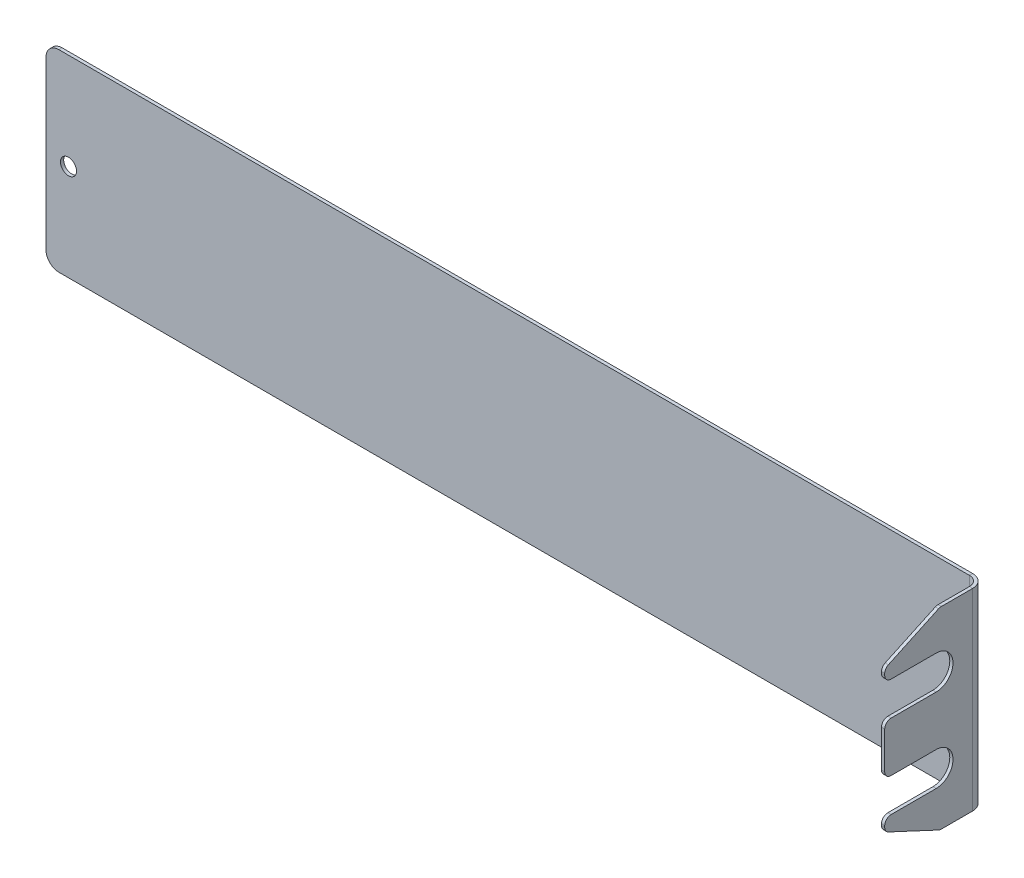
from build123d import *

# Parameters (mm, degrees)
SKETCH1_R                = 2.5
BASE_EXTRUDE_DEPTH       = 1
PROCESS_BENDS1_START     = 0.384624116
PROCESS_BENDS1_OUTLINE_W = 60
PROCESS_BENDS1_OUTLINE_H = 1
PROCESS_BENDS1_DEPTH     = 29.615375884
PROCESS_BENDS1_START_2   = -1.84192973
PROCESS_BENDS1_2_DEPTH   = 3.226553846
PROCESS_BENDS1_START_3   = -30
PROCESS_BENDS1_3_DEPTH   = 61
PROCESS_BENDS1_4_DEPTH   = 60


with BuildPart() as part:
    # Sketch1 → Base-Extrude (new body)
    with BuildSketch(Plane.XY):
        with BuildLine():
            Line((14, 18.25), (28, 18.25))
            ThreePointArc((28, 18.25), (29.414213562, 18.835786438), (30, 20.25))
            Line((30, 20.25), (30, 20.725859478))
            ThreePointArc((30, 20.725859478), (29.686782892, 21.800458695), (28.845236523, 22.538475052))
            Line((28.845236523, 22.538475052), (13.245791834, 29.812615574))
            ThreePointArc((13.245791834, 29.812615574), (12.833434539, 29.952592014), (12.400555311, 30))
            Line((12.400555311, 30), (-286, 30))
            ThreePointArc((-286, 30), (-288.828427125, 28.828427125), (-290, 26))
            Line((-290, 26), (-290, -26))
            ThreePointArc((-290, -26), (-288.828427125, -28.828427125), (-286, -30))
            Line((-286, -30), (12.400555311, -30))
            ThreePointArc((12.400555311, -30), (12.833434539, -29.952592014), (13.245791834, -29.812615574))
            Line((13.245791834, -29.812615574), (28.845236523, -22.538475052))
            ThreePointArc((28.845236523, -22.538475052), (29.686782892, -21.800458695), (30, -20.725859478))
            Line((30, -20.725859478), (30, -20.25))
            ThreePointArc((30, -20.25), (29.414213562, -18.835786438), (28, -18.25))
            Line((28, -18.25), (14, -18.25))
            ThreePointArc((14, -18.25), (8.75, -13), (14, -7.75))
            Line((14, -7.75), (28, -7.75))
            ThreePointArc((28, -7.75), (29.414213562, -7.164213562), (30, -5.75))
            Line((30, -5.75), (30, 5.75))
            ThreePointArc((30, 5.75), (29.414213562, 7.164213562), (28, 7.75))
            Line((28, 7.75), (14, 7.75))
            ThreePointArc((14, 7.75), (8.75, 13), (14, 18.25))
        make_face()
        with Locations((-283, 0)):
            Circle(SKETCH1_R, mode=Mode.SUBTRACT)
    extrude(amount=BASE_EXTRUDE_DEPTH)

    # Process-Bends1: read off the stored shape, not the designer's step
    # Process-Bends1 outline → Process-Bends1 (cut)
    with BuildSketch(Plane.YZ.offset(PROCESS_BENDS1_START)):
        with Locations((0, 0.5)):
            Rectangle(PROCESS_BENDS1_OUTLINE_W, PROCESS_BENDS1_OUTLINE_H)
    extrude(amount=PROCESS_BENDS1_DEPTH, mode=Mode.SUBTRACT)

    # Process-Bends1 2 outline → Process-Bends1 2 (add)
    with BuildSketch(Plane.YZ.offset(PROCESS_BENDS1_START_2)):
        with BuildLine():
            ThreePointArc((18.25, 15.384624116), (13, 10.134624116), (7.75, 15.384624116))
            Line((7.75, 15.384624116), (7.75, 29.384624116))
            ThreePointArc((7.75, 29.384624116), (7.164213562, 30.798837678), (5.75, 31.384624116))
            Line((5.75, 31.384624116), (-5.75, 31.384624116))
            ThreePointArc((-5.75, 31.384624116), (-7.164213562, 30.798837678), (-7.75, 29.384624116))
            Line((-7.75, 29.384624116), (-7.75, 15.384624116))
            ThreePointArc((-7.75, 15.384624116), (-13, 10.134624116), (-18.25, 15.384624116))
            Line((-18.25, 15.384624116), (-18.25, 29.384624116))
            ThreePointArc((-18.25, 29.384624116), (-18.835786438, 30.798837678), (-20.25, 31.384624116))
            Line((-20.25, 31.384624116), (-20.725859478, 31.384624116))
            ThreePointArc((-20.725859478, 31.384624116), (-21.800458695, 31.071407008), (-22.538475052, 30.229860639))
            Line((-22.538475052, 30.229860639), (-29.812615574, 14.63041595))
            ThreePointArc((-29.812615574, 14.63041595), (-29.952592014, 14.218058655), (-30, 13.785179427))
            Line((-30, 13.785179427), (-30, 1))
            Line((-30, 1), (30, 1))
            Line((30, 1), (30, 13.785179427))
            ThreePointArc((30, 13.785179427), (29.952592014, 14.218058655), (29.812615574, 14.63041595))
            Line((29.812615574, 14.63041595), (22.538475052, 30.229860639))
            ThreePointArc((22.538475052, 30.229860639), (21.800458695, 31.071407008), (20.725859478, 31.384624116))
            Line((20.725859478, 31.384624116), (20.25, 31.384624116))
            ThreePointArc((20.25, 31.384624116), (18.835786438, 30.798837678), (18.25, 29.384624116))
            Line((18.25, 29.384624116), (18.25, 15.384624116))
        make_face()
    extrude(amount=PROCESS_BENDS1_2_DEPTH)

    # Process-Bends1 3 outline → Process-Bends1 3 (cut)
    with BuildSketch(Plane(origin=(0, 0, 0), x_dir=(1, 0, 0), z_dir=(0, 1, 0)).offset(PROCESS_BENDS1_START_3)):
        with BuildLine():
            ThreePointArc((-2.615375884, 0), (0.213051241, -1.171572875), (1.384624116, -4))
            Line((1.384624116, -4), (1.384624116, -1))
            Line((1.384624116, -1), (0.384624116, -1))
            Line((0.384624116, -1), (0.384624116, 0))
            Line((0.384624116, 0), (-2.615375884, 0))
        make_face()
        with BuildLine():
            Line((0.384624116, -31.384624116), (0.384624116, -4))
            ThreePointArc((0.384624116, -4), (-0.236264867, -2.172479612), (-1.84192973, -1.101417407))
            Line((-1.84192973, -1.101417407), (-1.84192973, -31.384624116))
            Line((-1.84192973, -31.384624116), (0.384624116, -31.384624116))
        make_face()
    extrude(amount=PROCESS_BENDS1_3_DEPTH, mode=Mode.SUBTRACT)

    # Process-Bends1 4 outline → Process-Bends1 4 (add)
    with BuildSketch(Plane(origin=(0, 0, 0), x_dir=(1, 0, 0), z_dir=(0, 1, 0)).offset(PROCESS_BENDS1_START_3)):
        with BuildLine():
            ThreePointArc((-2.615375884, -1), (-2.22534241, -1.025462408), (-1.84192973, -1.101417407))
            Line((-1.84192973, -1.101417407), (-1.84192973, -1))
            Line((-1.84192973, -1), (-2.615375884, -1))
        make_face()
    extrude(amount=PROCESS_BENDS1_4_DEPTH)


solid = part.part
